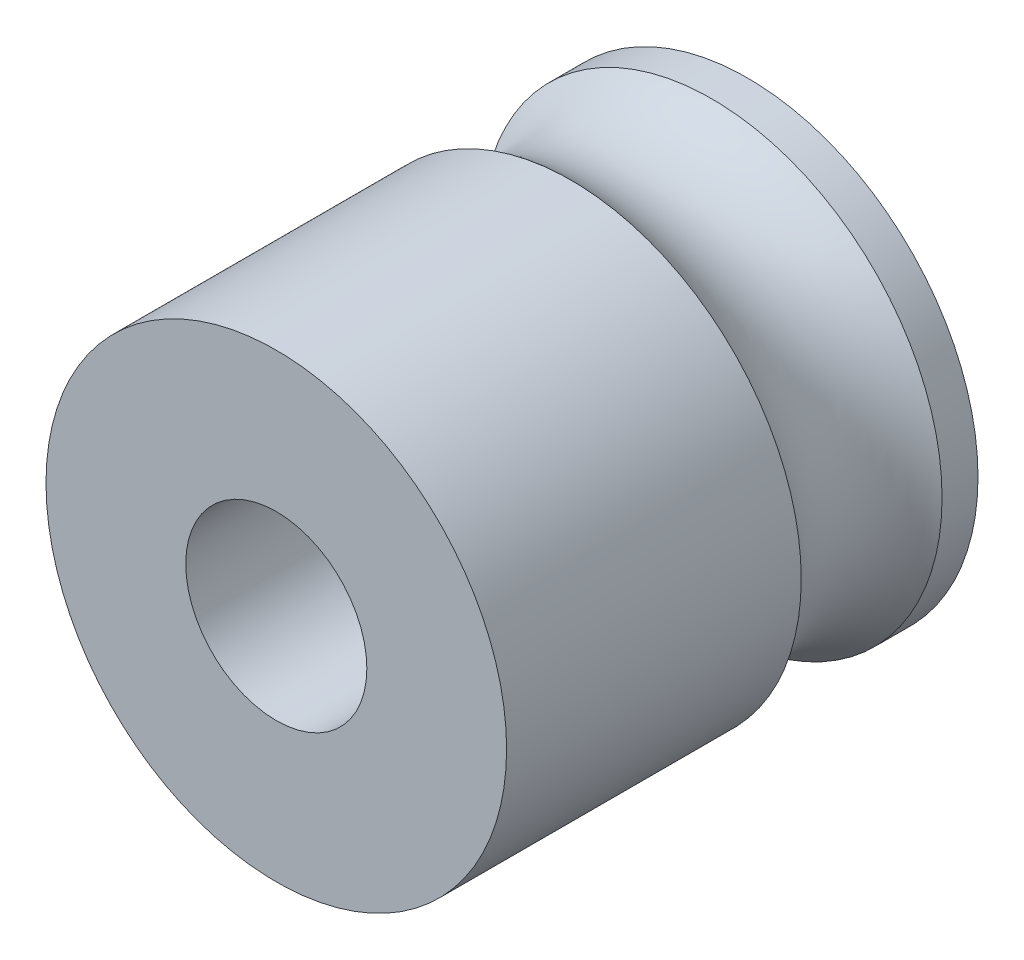
from build123d import *


with BuildPart() as part:
    # Sketch1 → Revolve1 (revolve)
    with BuildSketch(Plane(origin=(0, 0, 0), x_dir=(1, 0, 0), z_dir=(0, 1, 0))):
        with BuildLine():
            Line((-2.52, -8.2), (-2.52, 4.92))
            Line((-2.52, 4.92), (-6.41, 4.92))
            Line((-6.41, 4.92), (-6.41, 3.92))
            ThreePointArc((-6.41, 3.92), (-5.665915813, 1.96), (-6.41, 0))
            Line((-6.41, 0), (-6.41, -8.2))
            Line((-6.41, -8.2), (-2.52, -8.2))
        make_face()
    revolve(axis=Axis((0, 0, 0), (0, 0, 1)))


solid = part.part
